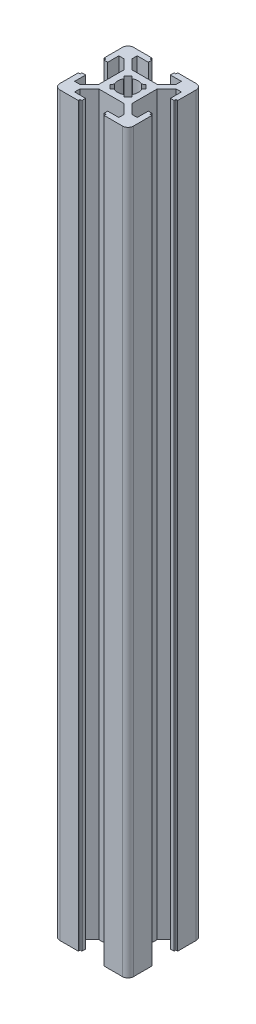
from build123d import *

# Parameters (mm, degrees)
DODANIE_WYCI_GNI_CIE1_DEPTH     = 807
SCHNITT_LINEAR_AUSTRAGEN1_DEPTH = 20


with BuildPart() as part:
    # Szkic1 → Dodanie-wyciągnięcie1 (new body)
    with BuildSketch(Plane(origin=(0, 0, 0), x_dir=(1, 0, 0), z_dir=(0, 1, 0))):
        with BuildLine():
            Line((7.06, -6), (4.5, -3.440546933))
            Line((4.5, -3.440546933), (4.5, 3.440546933))
            Line((4.5, 3.440546933), (7.06, 6))
            Line((7.06, 6), (8.5, 6))
            Line((8.5, 6), (8.5, 3))
            Line((8.5, 3), (9.5, 3))
            Line((9.5, 3), (9.5, 3.5))
            Line((9.5, 3.5), (10, 3.5))
            Line((10, 3.5), (10, 8.5))
            ThreePointArc((10, 8.5), (9.560660172, 9.560660172), (8.5, 10))
            Line((8.5, 10), (3.5, 10))
            Line((3.5, 10), (3.5, 9.5))
            Line((3.5, 9.5), (3, 9.5))
            Line((3, 9.5), (3, 8.5))
            Line((3, 8.5), (6, 8.5))
            Line((6, 8.5), (6, 7.06))
            Line((6, 7.06), (3.440546933, 4.5))
            Line((3.440546933, 4.5), (-3.440546933, 4.5))
            Line((-3.440546933, 4.5), (-6, 7.06))
            Line((-6, 7.06), (-6, 8.5))
            Line((-6, 8.5), (-3, 8.5))
            Line((-3, 8.5), (-3, 9.5))
            Line((-3, 9.5), (-3.5, 9.5))
            Line((-3.5, 9.5), (-3.5, 10))
            Line((-3.5, 10), (-8.5, 10))
            ThreePointArc((-8.5, 10), (-9.560660172, 9.560660172), (-10, 8.5))
            Line((-10, 8.5), (-10, 3.5))
            Line((-10, 3.5), (-9.5, 3.5))
            Line((-9.5, 3.5), (-9.5, 3))
            Line((-9.5, 3), (-8.5, 3))
            Line((-8.5, 3), (-8.5, 6))
            Line((-8.5, 6), (-7.06, 6))
            Line((-7.06, 6), (-4.5, 3.440546933))
            Line((-4.5, 3.440546933), (-4.5, -3.440546933))
            Line((-4.5, -3.440546933), (-7.06, -6))
            Line((-7.06, -6), (-8.5, -6))
            Line((-8.5, -6), (-8.5, -3))
            Line((-8.5, -3), (-9.5, -3))
            Line((-9.5, -3), (-9.5, -3.5))
            Line((-9.5, -3.5), (-10, -3.5))
            Line((-10, -3.5), (-10, -8.5))
            ThreePointArc((-10, -8.5), (-9.560660172, -9.560660172), (-8.5, -10))
            Line((-8.5, -10), (-3.5, -10))
            Line((-3.5, -10), (-3.5, -9.5))
            Line((-3.5, -9.5), (-3, -9.5))
            Line((-3, -9.5), (-3, -8.5))
            Line((-3, -8.5), (-6, -8.5))
            Line((-6, -8.5), (-6, -7.06))
            Line((-6, -7.06), (-3.440546933, -4.5))
            Line((-3.440546933, -4.5), (3.440546933, -4.5))
            Line((3.440546933, -4.5), (6, -7.06))
            Line((6, -7.06), (6, -8.5))
            Line((6, -8.5), (3, -8.5))
            Line((3, -8.5), (3, -9.5))
            Line((3, -9.5), (3.5, -9.5))
            Line((3.5, -9.5), (3.5, -10))
            Line((3.5, -10), (8.5, -10))
            ThreePointArc((8.5, -10), (9.560660172, -9.560660172), (10, -8.5))
            Line((10, -8.5), (10, -3.5))
            Line((10, -3.5), (9.5, -3.5))
            Line((9.5, -3.5), (9.5, -3))
            Line((9.5, -3), (8.5, -3))
            Line((8.5, -3), (8.5, -6))
            Line((8.5, -6), (7.06, -6))
        make_face()
        with BuildLine():
            ThreePointArc((-1.271309214, 2.438498079), (0, 2.75), (1.271309214, 2.438498079))
            Line((1.271309214, 2.438498079), (1.944543648, 3.00520382))
            Line((1.944543648, 3.00520382), (3.00520382, 1.944543648))
            Line((3.00520382, 1.944543648), (2.438498079, 1.271309214))
            ThreePointArc((2.438498079, 1.271309214), (2.75, 0), (2.438498079, -1.271309214))
            Line((2.438498079, -1.271309214), (3.00520382, -1.944543648))
            Line((3.00520382, -1.944543648), (1.944543648, -3.00520382))
            Line((1.944543648, -3.00520382), (1.271309214, -2.438498079))
            ThreePointArc((1.271309214, -2.438498079), (0, -2.75), (-1.271309214, -2.438498079))
            Line((-1.271309214, -2.438498079), (-1.944543648, -3.00520382))
            Line((-1.944543648, -3.00520382), (-3.00520382, -1.944543648))
            Line((-3.00520382, -1.944543648), (-2.438498079, -1.271309214))
            ThreePointArc((-2.438498079, -1.271309214), (-2.75, 0), (-2.438498079, 1.271309214))
            Line((-2.438498079, 1.271309214), (-3.00520382, 1.944543648))
            Line((-3.00520382, 1.944543648), (-1.944543648, 3.00520382))
            Line((-1.944543648, 3.00520382), (-1.271309214, 2.438498079))
        make_face(mode=Mode.SUBTRACT)
    extrude(amount=DODANIE_WYCI_GNI_CIE1_DEPTH)

    # Skizze1 → Schnitt-Linear austragen1 (cut, symmetric)
    with BuildSketch(Plane.XY):
        Polygon((-83.496312338, 200), (63.910757592, 200), (55.14879889, 860.754768005), (-83.496312338, 858.91626029), align=None)
    extrude(amount=SCHNITT_LINEAR_AUSTRAGEN1_DEPTH, both=True, mode=Mode.SUBTRACT)


solid = part.part
